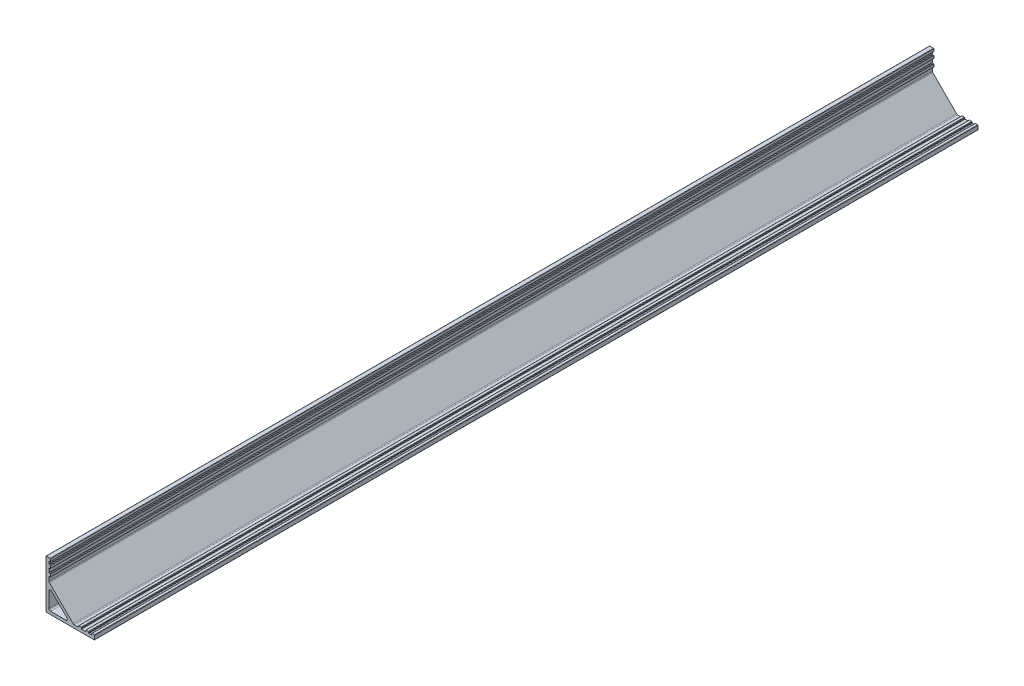
from build123d import *

# Parameters (mm, degrees)
EXTRUDE_THIN4_DEPTH = 300
FILLET2_R           = 0.5
FILLET4_R           = 0.1


# Read off the part's stored shape, not the designer's step: Extrude-Thin4
with BuildPart() as part:
    # Extrude-Thin4 outline → Extrude-Thin4 (new body)
    with BuildSketch(Plane.XY):
        Polygon((-0.5, 16), (-0.5, -0.5), (16, -0.5), (16, 1), (15, 1), (15, 0.5), (14, 0.5), (14, 1), (13, 1), (13, 0.5), (11.5, 0.5), (11.5, 1), (10.5, 1), (10.5, 0.5), (8.890378054, 0.5), (0.5, 8.890378054), (0.5, 10.5), (1, 10.5), (1, 11.5), (0.5, 11.5), (0.5, 13), (1, 13), (1, 14), (0.5, 14), (0.5, 15), (1, 15), (1, 16), align=None)
        Polygon((7.476164492, 0.5), (0.5, 0.5), (0.5, 7.476164492), align=None, mode=Mode.SUBTRACT)
    extrude(amount=EXTRUDE_THIN4_DEPTH)

    # Fillet2
    fillet2_edges = [part.edges().sort_by_distance(p)[0] for p in [
        (-0.5, -0.5, 150),
        (0.5, 0.5, 150),
        (0.5, 7.476164492, 150),
        (0.5, 8.890378054, 150),
        (7.476164492, 0.5, 150),
        (8.890378054, 0.5, 150),
    ]]
    fillet(fillet2_edges, radius=FILLET2_R)

    # Fillet4
    fillet4_edges = [part.edges().sort_by_distance(p)[0] for p in [
        (16, -0.5, 150),
        (-0.5, 16, 150),
        (1, 16, 150),
        (1, 15, 150),
        (0.5, 15, 150),
        (15, 0.5, 150),
        (15, 1, 150),
        (16, 1, 150),
        (0.5, 11.5, 150),
        (0.5, 10.5, 150),
        (0.5, 14, 150),
        (0.5, 13, 150),
        (13, 0.5, 150),
        (14, 0.5, 150),
        (10.5, 0.5, 150),
        (11.5, 0.5, 150),
        (11.5, 1, 150),
        (10.5, 1, 150),
        (14, 1, 150),
        (13, 1, 150),
        (1, 13, 150),
        (1, 14, 150),
        (1, 10.5, 150),
        (1, 11.5, 150),
    ]]
    fillet(fillet4_edges, radius=FILLET4_R)


solid = part.part
